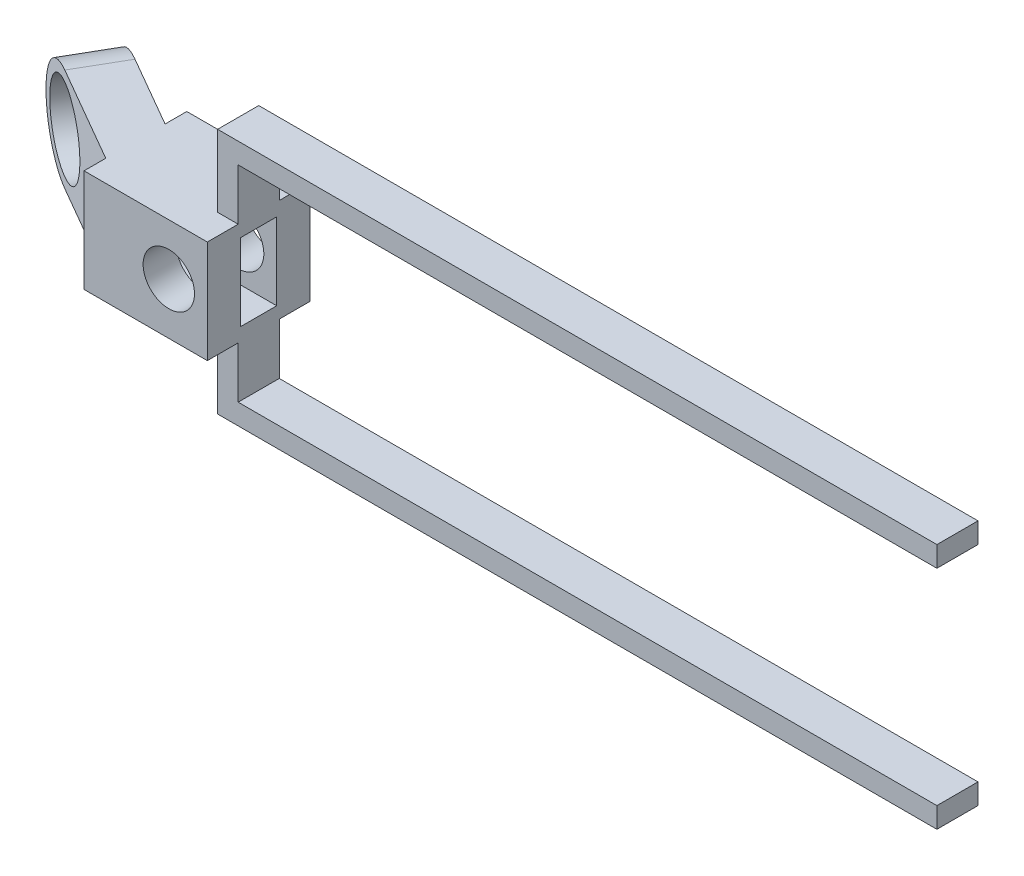
from build123d import *

# Parameters (mm, degrees)
SKETCH1_W               = 12.7
SKETCH1_H               = 12.7
BOSS_EXTRUDE1_DEPTH     = 12.7
SKETCH3_W               = 3.81
SKETCH3_H               = 8.89
CUT_EXTRUDE1_DEPTH      = 93.361399405
SKETCH4_W               = 4.445
SKETCH4_H               = 9.525
CUT_EXTRUDE2_DEPTH      = 12.7
SKETCH5_R               = 3.175
CUT_EXTRUDE3_DEPTH      = 12.7
BOSS_EXTRUDE3_DEPTH     = 12.7
BOSS_EXTRUDE2_START     = -6.35
BOSS_EXTRUDE2_OUTLINE_R = 5.08
BOSS_EXTRUDE2_DEPTH     = 6.35


# Read off the part's stored shape, not the designer's step: Boss-Extrude2
with BuildPart() as part:
    # Sketch1 → Boss-Extrude1 (new body)
    with BuildSketch(Plane.XY):
        with Locations((6.35, 6.35)):
            Rectangle(SKETCH1_W, SKETCH1_H)
        Polygon((12.7, 12.7), (12.7, 0), (12.7, -8.89), (101.6, -8.89), (101.6, -6.35), (15.24, -6.35), (15.24, 19.05), (101.6, 19.05), (101.6, 21.59), (12.7, 21.59), align=None)
    extrude(amount=BOSS_EXTRUDE1_DEPTH)

    # Sketch3 → Cut-Extrude1 (cut, through all)
    with BuildSketch(Plane.ZY.offset(-12.7)):
        with Locations((1.905, 17.145)):
            Rectangle(SKETCH3_W, SKETCH3_H)
        with Locations((10.795, 17.145)):
            Rectangle(SKETCH3_W, SKETCH3_H)
        with Locations((10.795, -4.445)):
            Rectangle(SKETCH3_W, SKETCH3_H)
        with Locations((1.905, -4.445)):
            Rectangle(SKETCH3_W, SKETCH3_H)
    extrude(amount=-CUT_EXTRUDE1_DEPTH, mode=Mode.SUBTRACT)

    # Sketch4 → Cut-Extrude2 (cut)
    with BuildSketch(Plane(origin=(15.24, 0, 0), x_dir=(0, 0, -1), z_dir=(1, 0, 0))):
        with Locations((-6.35, 6.35)):
            Rectangle(SKETCH4_W, SKETCH4_H)
    extrude(amount=-CUT_EXTRUDE2_DEPTH, mode=Mode.SUBTRACT)

    # Sketch5 → Cut-Extrude3 (cut)
    with BuildSketch(Plane.XY.offset(12.7)):
        with Locations((10.4775, 6.35)):
            Circle(SKETCH5_R)
    extrude(amount=-CUT_EXTRUDE3_DEPTH, mode=Mode.SUBTRACT)

    # Sketch7 → Boss-Extrude3 (add)
    with BuildSketch(Plane(origin=(0, 12.7, 0), x_dir=(1, 0, 0), z_dir=(0, 1, 0))):
        Polygon((0, -2.683825791), (-3.175, -8.183087105), (0, -10.016174209), align=None)
    extrude(amount=-BOSS_EXTRUDE3_DEPTH)

    # Boss-Extrude2 outline → Boss-Extrude2 (add)
    with BuildSketch(Plane(origin=(0.622783942, 0, 10.375738686), x_dir=(0.8660254037844416, 0, 0.499999999999995), z_dir=(-0.49999999999999495, 0, 0.8660254037844415)).offset(BOSS_EXTRUDE2_START)):
        with BuildLine():
            Line((-0.719128953, 12.7), (-14.545303163, 12.7))
            ThreePointArc((-14.545303163, 12.7), (-20.895303163, 6.35), (-14.545303163, 0))
            Line((-14.545303163, 0), (-0.719128953, 0))
            Line((-0.719128953, 0), (-0.719128953, 12.7))
        make_face()
        with Locations((-14.545303163, 6.35)):
            Circle(BOSS_EXTRUDE2_OUTLINE_R, mode=Mode.SUBTRACT)
    extrude(amount=BOSS_EXTRUDE2_DEPTH)


solid = part.part
